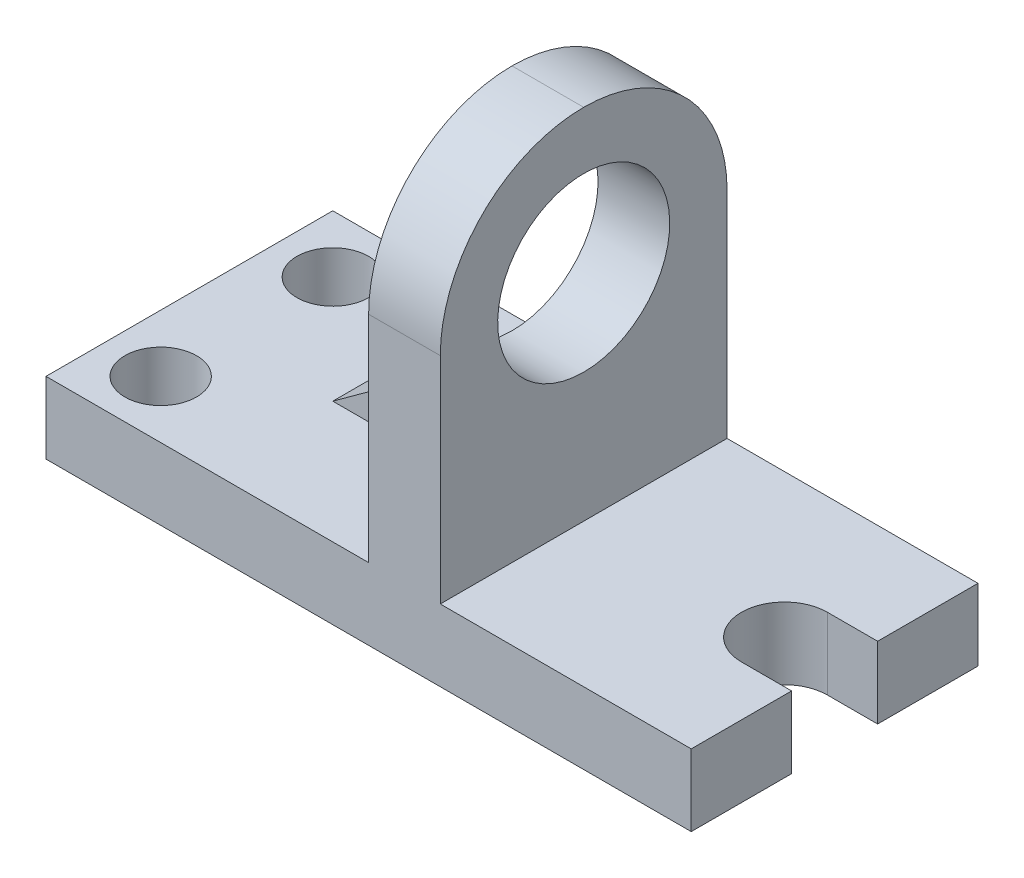
from build123d import *

# Parameters (mm, degrees)
EXTRUDE_1_DEPTH      = 10
EXTRUDE_1_DEPTH_BACK = 10
SKETCH_1_W           = 40
SKETCH_1_H           = 5
EXTRUDE_2_DEPTH      = 1.5
EXTRUDE_2_DEPTH_BACK = 1.5
FILLET_1_R           = 10
SKETCH_2_R           = 6
CUT_EXTRUDE_1_DEPTH  = 37.912057651
SKETCH_4_R           = 3
CUT_EXTRUDE_3_DEPTH  = 34.541019662
SKETCH_5_W           = 20
SKETCH_5_H           = 5
EXTRUDE_3_DEPTH      = 5
SKETCH_3_R           = 2.5
CUT_EXTRUDE_4_DEPTH  = 37.742346142


with BuildPart() as part:
    # Эскиз1 → Бобышка-Вытянуть1 (new, two sides: drawn at the far end of the back side and taken through both)
    with BuildSketch(Plane.XY.offset(-EXTRUDE_1_DEPTH_BACK)):
        Rectangle(SKETCH_1_W, SKETCH_1_H)
        Polygon((-2.5, 27.5), (-2.5, 10.5), (-2.5, 2.5), (2.5, 2.5), (2.5, 27.5), align=None)
    extrude(amount=EXTRUDE_1_DEPTH + EXTRUDE_1_DEPTH_BACK)

    # Эскиз1<3> → Бобышка-Вытянуть2 (add, two sides: drawn at the far end of the back side and taken through both)
    with BuildSketch(Plane.XY.offset(-EXTRUDE_2_DEPTH_BACK)):
        Polygon((-2.5, 10.5), (-13.5, 2.5), (-2.5, 2.5), align=None)
    extrude(amount=EXTRUDE_2_DEPTH + EXTRUDE_2_DEPTH_BACK)

    # Скругление1
    fillet_1_edges = [part.edges().sort_by_distance(p)[0] for p in [
        (0, 27.5, 10),
        (0, 27.5, -10),
    ]]
    fillet(fillet_1_edges, radius=FILLET_1_R - 0.0001)  # a hair under: the kernel refuses the full size

    # Эскиз2 → Вырез-Вытянуть1 (cut, through all)
    with BuildSketch(Plane.ZY.offset(2.5)):
        with Locations(Location((0, 17.5, 0), (0, 0, 270))):
            Circle(SKETCH_2_R)
    extrude(amount=-CUT_EXTRUDE_1_DEPTH, mode=Mode.SUBTRACT)

    # Эскиз4 → Вырез-Вытянуть3 (cut, through all)
    with BuildSketch(Plane(origin=(0, 2.5, 0), x_dir=(1, 0, 0), z_dir=(0, 1, 0))):
        with BuildLine():
            Line((20, 3), (16.5, 3))
            ThreePointArc((16.5, 3), (18.621320344, 2.121320344), (19.5, 0))
            ThreePointArc((19.5, 0), (18.621320344, -2.121320344), (16.5, -3))
            Line((16.5, -3), (20, -3))
            Line((20, -3), (20, 3))
        make_face()
        with Locations((16.5, 0)):
            Circle(SKETCH_4_R)
    extrude(amount=-CUT_EXTRUDE_3_DEPTH, mode=Mode.SUBTRACT)

    # Эскиз5 → Бобышка-Вытянуть3 (add)
    with BuildSketch(Plane.ZY.offset(20)):
        Rectangle(SKETCH_5_W, SKETCH_5_H)
    extrude(amount=EXTRUDE_3_DEPTH)

    # Эскиз3 → Вырез-Вытянуть4 (cut, through all)
    with BuildSketch(Plane(origin=(0, 2.5, 0), x_dir=(1, 0, 0), z_dir=(0, 1, 0))):
        with Locations(Location((-21, -6, 0), (0, 0, 270))):
            Circle(SKETCH_3_R)
    cut_extrude_4 = extrude(amount=-CUT_EXTRUDE_4_DEPTH, mode=Mode.SUBTRACT)

    # Зеркальное отражение1: Вырез-Вытянуть4 across plane
    add(cut_extrude_4.mirror(Plane.XY), mode=Mode.SUBTRACT)


solid = part.part
